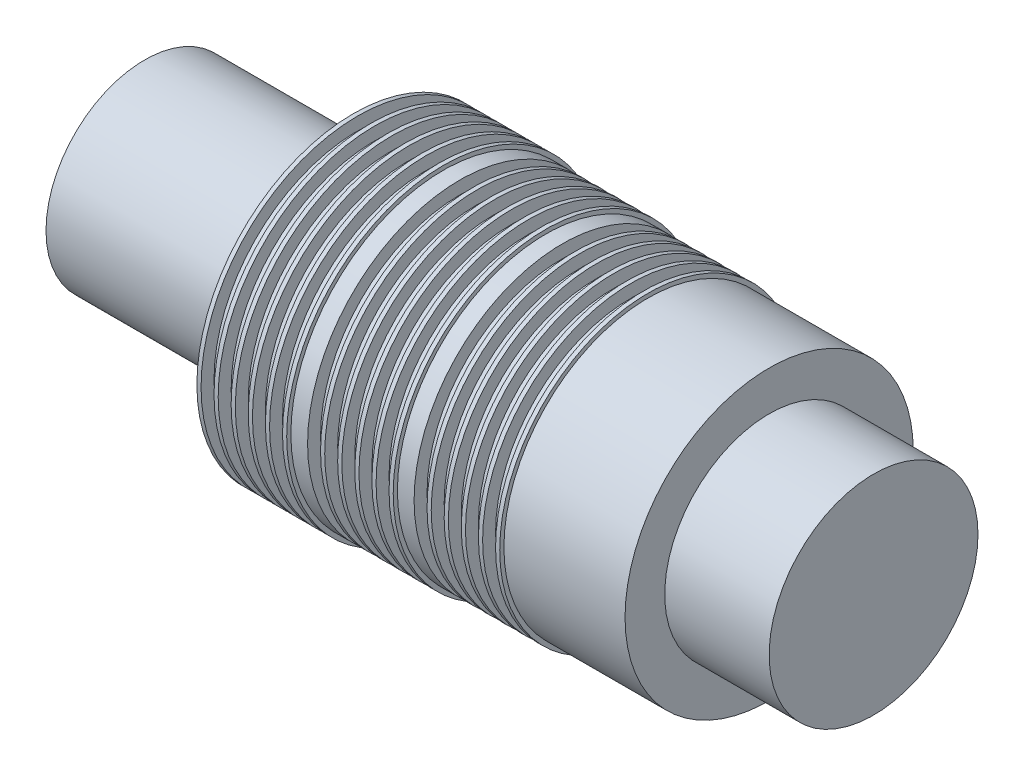
from build123d import *

# Parameters (mm, degrees)
SKETCH3_R           = 17.357767681
CUT_EXTRUDE1_DEPTH  = 114.5794
SKETCH4_R           = 6.35
BOSS_EXTRUDE1_DEPTH = 12.7
SKETCH5_R           = 8.763
SKETCH5_R_2         = 6.35
BOSS_EXTRUDE2_DEPTH = 6.35


with BuildPart() as part:
    # Sketch1 → Revolve1 (revolve)
    with BuildSketch(Plane.XY):
        Polygon((12.954, 9.525), (12.954, 8.7376), (13.7414, 8.7376), (13.7414, 9.525), (13.9954, 9.525), (13.9954, 8.7376), (14.7828, 8.7376), (14.7828, 9.525), (15.0368, 9.525), (15.0368, 8.7376), (15.8242, 8.7376), (15.8242, 9.525), (16.0782, 9.525), (16.0782, 8.7376), (16.8656, 8.7376), (16.8656, 9.525), (17.1196, 9.525), (17.1196, 8.7376), (17.907, 8.7376), (17.907, 9.525), (18.161, 9.525), (18.161, 9.271), (19.177, 9.271), (19.177, 8.4836), (19.9644, 8.4836), (19.9644, 9.271), (20.2184, 9.271), (20.2184, 8.4836), (21.0058, 8.4836), (21.0058, 9.271), (21.2598, 9.271), (21.2598, 8.4836), (22.0472, 8.4836), (22.0472, 9.271), (22.3012, 9.271), (22.3012, 8.4836), (23.0886, 8.4836), (23.0886, 9.271), (23.3426, 9.271), (23.3426, 8.4836), (24.13, 8.4836), (24.13, 9.271), (24.384, 9.271), (24.384, 9.017), (25.4, 9.017), (25.4, 8.2296), (26.1874, 8.2296), (26.1874, 9.017), (26.4414, 9.017), (26.4414, 8.2296), (27.2288, 8.2296), (27.2288, 9.017), (27.4828, 9.017), (27.4828, 8.2296), (28.2702, 8.2296), (28.2702, 9.017), (28.5242, 9.017), (28.5242, 8.2296), (29.3116, 8.2296), (29.3116, 9.017), (29.5656, 9.017), (29.5656, 8.2296), (30.353, 8.2296), (30.353, 9.017), (30.607, 9.017), (30.607, 8.763), (31.623, 8.763), (31.623, 7.9756), (32.4104, 7.9756), (32.4104, 8.763), (32.6644, 8.763), (32.6644, 7.9756), (33.4518, 7.9756), (33.4518, 8.763), (33.7058, 8.763), (33.7058, 7.9756), (34.4932, 7.9756), (34.4932, 8.763), (34.7472, 8.763), (34.7472, 7.9756), (35.5346, 7.9756), (35.5346, 8.763), (35.7886, 8.763), (35.7886, 7.9756), (36.576, 7.9756), (36.576, 8.763), (36.83, 8.763), (36.83, 8.509), (37.846, 8.509), (37.846, 7.7216), (38.6334, 7.7216), (38.6334, 8.509), (38.8874, 8.509), (38.8874, 7.7216), (39.6748, 7.7216), (39.6748, 8.509), (39.9288, 8.509), (39.9288, 7.7216), (40.7162, 7.7216), (40.7162, 8.509), (40.9702, 8.509), (40.9702, 7.7216), (41.7576, 7.7216), (41.7576, 8.509), (42.0116, 8.509), (42.0116, 7.7216), (42.799, 7.7216), (42.799, 8.509), (43.053, 8.509), (43.053, 8.255), (44.069, 8.255), (44.069, 7.4676), (44.8564, 7.4676), (44.8564, 8.255), (45.1104, 8.255), (45.1104, 7.4676), (45.8978, 7.4676), (45.8978, 8.255), (46.1518, 8.255), (46.1518, 7.4676), (46.9392, 7.4676), (46.9392, 8.255), (47.1932, 8.255), (47.1932, 7.4676), (47.9806, 7.4676), (47.9806, 8.255), (48.2346, 8.255), (48.2346, 7.4676), (49.022, 7.4676), (49.022, 8.255), (49.276, 8.255), (49.276, 5.999988), (69.596, 5.999988), (69.596, 0), (61.976, 0), (0, 0), (0, 5.999988), (12.7, 5.999988), (12.7, 9.525), align=None)
    revolve(axis=Axis((0, 0, 0), (1, 0, 0)))

    # Sketch3 → Cut-Extrude1 (cut)
    with BuildSketch(Plane(origin=(31.623, 0, 0), x_dir=(0, 0, -1), z_dir=(1, 0, 0))):
        Circle(SKETCH3_R)
    extrude(amount=CUT_EXTRUDE1_DEPTH, mode=Mode.SUBTRACT)

    # Sketch4 → Boss-Extrude1 (add)
    with BuildSketch(Plane(origin=(31.623, 0, 0), x_dir=(0, 0, -1), z_dir=(1, 0, 0))):
        Circle(SKETCH4_R)
    extrude(amount=BOSS_EXTRUDE1_DEPTH)

    # Sketch5 → Boss-Extrude2 (add)
    with BuildSketch(Plane(origin=(31.623, 0, 0), x_dir=(0, 0, -1), z_dir=(1, 0, 0))):
        Circle(SKETCH5_R)
        Circle(SKETCH5_R_2, mode=Mode.SUBTRACT)
    extrude(amount=BOSS_EXTRUDE2_DEPTH)


solid = part.part
